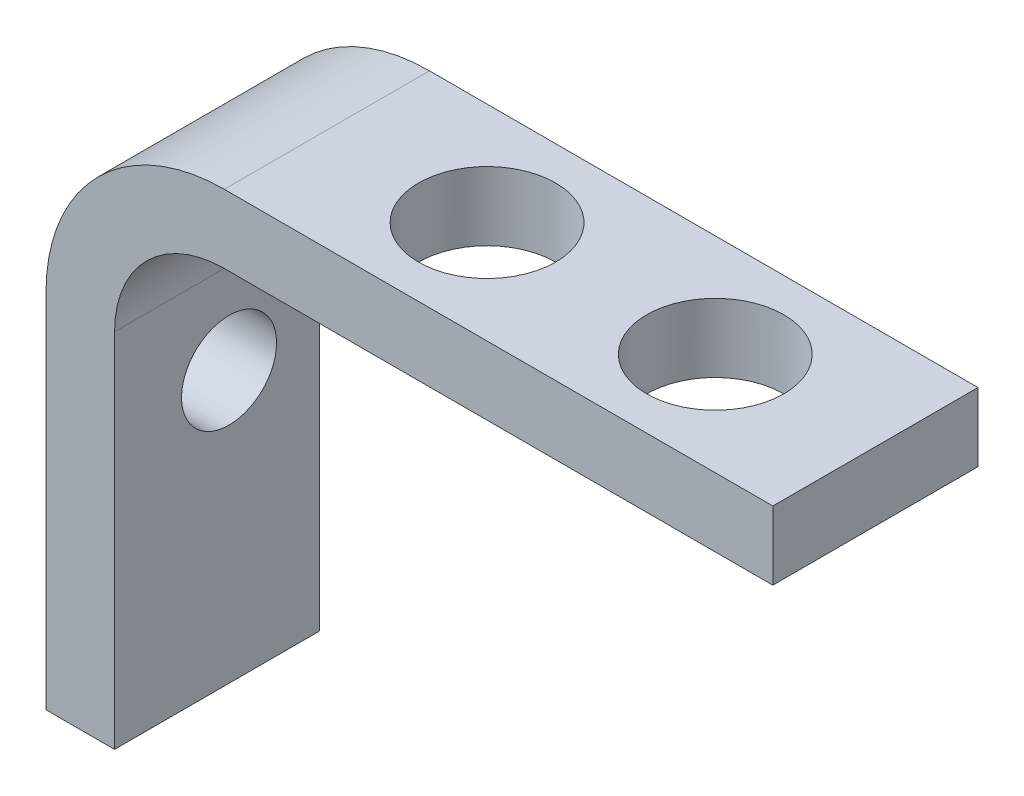
from build123d import *

# Parameters (mm, degrees)
BOSS_EXTRUDE1_DEPTH = 4.75
CUT_EXTRUDE1_REACH  = 22.275
SKETCH2_R           = 1.1
SKETCH3_R           = 1.5875
CUT_EXTRUDE2_DEPTH  = 2.54


with BuildPart() as part:
    # Sketch1 → Boss-Extrude1 (new body)
    with BuildSketch(Plane.XY):
        with BuildLine():
            Line((0, 0), (0, 8.3725))
            ThreePointArc((0, 8.3725), (0.743948776, 10.168551224), (2.54, 10.9125))
            Line((2.54, 10.9125), (15.24, 10.9125))
            Line((15.24, 10.9125), (15.24, 12.5))
            Line((15.24, 12.5), (2.54, 12.5))
            ThreePointArc((2.54, 12.5), (-0.378583239, 11.291083239), (-1.5875, 8.3725))
            Line((-1.5875, 8.3725), (-1.5875, 0))
            Line((-1.5875, 0), (0, 0))
        make_face()
    extrude(amount=BOSS_EXTRUDE1_DEPTH)

    # Sketch2 → Cut-Extrude1 (cut, up to next)
    with BuildSketch(Plane(origin=(0, 0, 0), x_dir=(0, 0, -1), z_dir=(1, 0, 0)), mode=Mode.PRIVATE) as cut_extrude1_sk1:
        with Locations((-2.1, 6.277)):
            Circle(SKETCH2_R)
    cut_extrude1_tool1 = extrude(cut_extrude1_sk1.sketch, amount=-CUT_EXTRUDE1_REACH, mode=Mode.PRIVATE) & part.part
    add(cut_extrude1_tool1.solids().sort_by_distance((0, 6.277, 2.1))[0], mode=Mode.SUBTRACT)

    # Sketch3 → Cut-Extrude2 (cut)
    with BuildSketch(Plane.XZ.offset(-10.9125)):
        with Locations((11.5316, 2.375)):
            Circle(SKETCH3_R)
        with Locations((6.2484, 2.375)):
            Circle(SKETCH3_R)
    extrude(amount=-CUT_EXTRUDE2_DEPTH, mode=Mode.SUBTRACT)


solid = part.part
